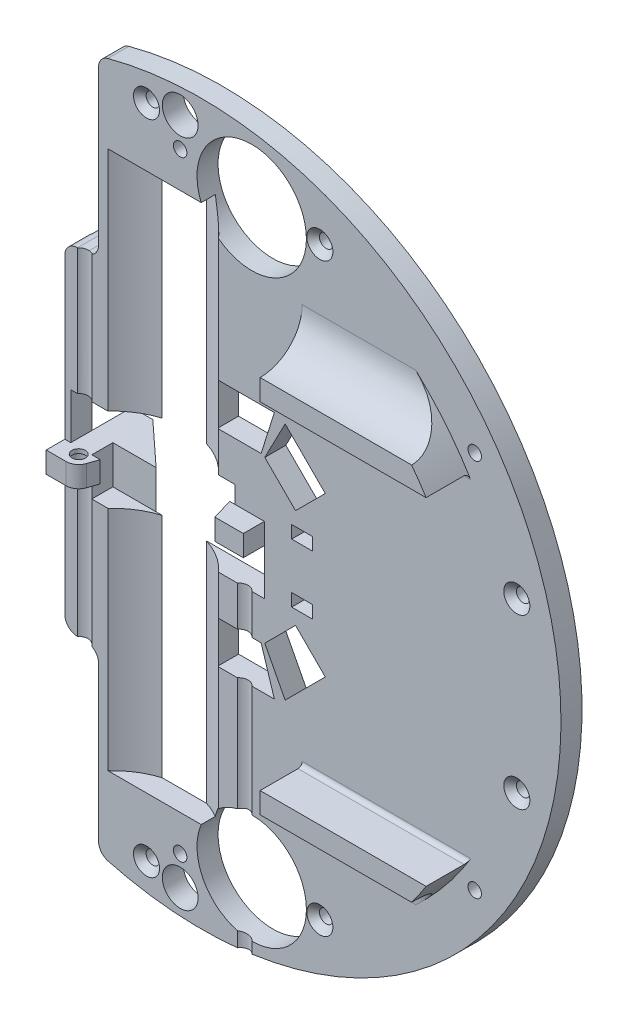
from build123d import *

# Parameters (mm, degrees)
SKETCH1_R               = 1.6
SKETCH1_R_2             = 4.25
SKETCH1_R_3             = 13
BOSS_EXTRUDE2_DEPTH     = 5
BOSS_EXTRUDE3_DEPTH     = 10
FILLET1_R               = 10
FILLET2_R               = 1
SKETCH5_R               = 1.6
CUT_EXTRUDE2_DEPTH      = 10
CHAMFER1_SIZE           = 1.5
CHAMFER2_SIZE           = 1.5
CUT_EXTRUDE3_DEPTH      = 10
CUT_EXTRUDE4_DEPTH      = 64
CUT_EXTRUDE4_DEPTH_BACK = 64
SKETCH10_R              = 17.8
CUT_EXTRUDE5_DEPTH      = 62.5
SKETCH13_W              = 8.207106088
SKETCH13_H              = 5
BOSS_EXTRUDE4_DEPTH     = 5
CUT_EXTRUDE6_DEPTH      = 110
CUT_EXTRUDE6_DEPTH_BACK = 4
SKETCH14_R              = 2.25
CUT_EXTRUDE7_DEPTH      = 15
SKETCH16_W              = 8.411411006
SKETCH16_H              = 5
BOSS_EXTRUDE5_DEPTH     = 5
CUT_EXTRUDE8_DEPTH      = 40
CUT_EXTRUDE8_DEPTH_BACK = 4
SKETCH17_R              = 2.25
CUT_EXTRUDE9_DEPTH      = 7
SKETCH19_R              = 1.6
CUT_EXTRUDE10_DEPTH     = 7
CUT_EXTRUDE11_START     = 45
SKETCH20_R              = 2.25
CUT_EXTRUDE11_DEPTH     = 45
SKETCH21_W              = 63.368942454
SKETCH21_H              = 8
CUT_EXTRUDE12_DEPTH     = 3
SKETCH22_W              = 5
SKETCH22_H              = 3
CUT_EXTRUDE13_DEPTH     = 5
FILLET3_R               = 3
BOSS_EXTRUDE6_DEPTH     = 9.5
SKETCH25_R              = 2.25
CUT_EXTRUDE14_DEPTH     = 9.5
BOSS_EXTRUDE7_DEPTH     = 30.35
BOSS_EXTRUDE8_DEPTH     = 39.45


# Some blends are built 0.0001 mm under size
with BuildPart() as part:
    # Sketch1 → Boss-Extrude2 (new body)
    with BuildSketch(Plane(origin=(0, 0, 0), x_dir=(0, 1, 0), z_dir=(0, 0, 1))):
        with BuildLine():
            Line((-40, 24.388755563), (-40, 32.411411006))
            Line((-40, 32.411411006), (40, 32.411411006))
            Line((40, 32.411411006), (40, 24.411411006))
            Line((40, 24.411411006), (81.941033754, 24.411411006))
            ThreePointArc((81.941033754, 24.411411006), (0.011819235, -85.499999183), (-81.947779727, 24.388755563))
            Line((-81.947779727, 24.388755563), (-40, 24.388755563))
        make_face()
        with Locations(Location((-20, -75, 0), (0, 0, 270))):
            Circle(SKETCH1_R, mode=Mode.SUBTRACT)
        with Locations(Location((20, -75, 0), (0, 0, 90))):
            Circle(SKETCH1_R, mode=Mode.SUBTRACT)
        with Locations(Location((-69.5, -28.2, 0), (0, 0, 270))):
            Circle(SKETCH1_R, mode=Mode.SUBTRACT)
        with Locations(Location((-78, 13, 0), (0, 0, 90))):
            Circle(SKETCH1_R, mode=Mode.SUBTRACT)
        with Locations(Location((-79.5, 5, 0), (0, 0, 90))):
            Circle(SKETCH1_R_2, mode=Mode.SUBTRACT)
        with Locations(Location((-69, -12, 0), (0, 0, 90))):
            Circle(SKETCH1_R_3, mode=Mode.SUBTRACT)
        with Locations(Location((69, -12, 0), (0, 0, 270))):
            Circle(SKETCH1_R_3, mode=Mode.SUBTRACT)
        with Locations(Location((79.5, 5, 0), (0, 0, 270))):
            Circle(SKETCH1_R_2, mode=Mode.SUBTRACT)
        with Locations(Location((78, 13, 0), (0, 0, 270))):
            Circle(SKETCH1_R, mode=Mode.SUBTRACT)
        with Locations(Location((69.5, -28.2, 0), (0, 0, 90))):
            Circle(SKETCH1_R, mode=Mode.SUBTRACT)
    extrude(amount=BOSS_EXTRUDE2_DEPTH)

    # Sketch2 → Boss-Extrude3 (add)
    with BuildSketch(Plane.XY.offset(5)):
        with BuildLine():
            Line((60, 45), (24, 45))
            Line((24, 45), (24, 40))
            Line((24, 40), (63.442887702, 40))
            ThreePointArc((63.442887702, 40), (61.772053803, 42.534848876), (60, 45))
        make_face()
        with BuildLine():
            Line((24, -45), (24, -40))
            Line((24, -40), (63.442887702, -40))
            ThreePointArc((63.442887702, -40), (61.772053803, -42.534848876), (60, -45))
            Line((60, -45), (24, -45))
        make_face()
    extrude(amount=BOSS_EXTRUDE3_DEPTH)

    # Fillet1
    fillet1_edges = [part.edges().sort_by_distance(p)[0] for p in [
        (42, -45, 5),
        (42, 45, 5),
    ]]
    fillet(fillet1_edges, radius=FILLET1_R - 0.0001)  # a hair under: the kernel refuses the full size

    # Fillet2
    fillet2_edges = [part.edges().sort_by_distance(p)[0] for p in [
        (43.721443851, 40, 5),
        (43.721443851, -40, 5),
    ]]
    fillet(fillet2_edges, radius=FILLET2_R)

    # Sketch5 → Cut-Extrude2 (cut)
    with BuildSketch(Plane.XY.offset(5)):
        with Locations((65, 45)):
            Circle(SKETCH5_R)
        with Locations((-5, 72.5)):
            Circle(SKETCH5_R)
        with Locations((65, -45)):
            Circle(SKETCH5_R)
        with Locations((-5, -72.5)):
            Circle(SKETCH5_R)
    extrude(amount=-CUT_EXTRUDE2_DEPTH, mode=Mode.SUBTRACT)

    # Chamfer1
    chamfer1_edges = [part.edges().sort_by_distance(p)[0] for p in [
        (73.4, -20, 5),
        (76.6, 20, 5),
        (26.6, -69.5, 5),
        (-11.4, -78, 5),
        (-14.6, 78, 5),
        (29.8, 69.5, 5),
    ]]
    chamfer(chamfer1_edges, length=CHAMFER1_SIZE)

    # Chamfer2
    # the kernel refuses this chamfer: 1.5 mm, written as the material it takes off along each edge
    with BuildSketch(Plane(origin=(-5, -72.5, 0), x_dir=(1, 0, 0), z_dir=(0, -1, 0))) as chamfer2_piece_1:
        Polygon((1.6, CHAMFER2_SIZE), (1.6 + CHAMFER2_SIZE, 0), (1.6, 0), align=None)
    revolve(axis=Axis((-5, -72.5, 0), (0, 0, 1)), mode=Mode.SUBTRACT)
    with BuildSketch(Plane(origin=(65, -45, 0), x_dir=(1, 0, 0), z_dir=(0, -1, 0))) as chamfer2_piece_2:
        Polygon((1.6, CHAMFER2_SIZE), (1.6 + CHAMFER2_SIZE, 0), (1.6, 0), align=None)
    revolve(axis=Axis((65, -45, 0), (0, 0, 1)), mode=Mode.SUBTRACT)
    with BuildSketch(Plane(origin=(-5, 72.5, 0), x_dir=(1, 0, 0), z_dir=(0, -1, 0))) as chamfer2_piece_3:
        Polygon((1.6, CHAMFER2_SIZE), (1.6 + CHAMFER2_SIZE, 0), (1.6, 0), align=None)
    revolve(axis=Axis((-5, 72.5, 0), (0, 0, 1)), mode=Mode.SUBTRACT)
    with BuildSketch(Plane(origin=(65, 45, 0), x_dir=(1, 0, 0), z_dir=(0, -1, 0))) as chamfer2_piece_4:
        Polygon((1.6, CHAMFER2_SIZE), (1.6 + CHAMFER2_SIZE, 0), (1.6, 0), align=None)
    revolve(axis=Axis((65, 45, 0), (0, 0, 1)), mode=Mode.SUBTRACT)

    # Sketch9 → Cut-Extrude3 (cut)
    with BuildSketch(Plane.XY.offset(5)):
        Polygon((14.237615434, -19.486352775), (3.879751058, -19.486352775), (3.879751058, -29.486352775), (17.379751058, -29.486352775), align=None)
        Polygon((15.10847152, -19.115496689), (22.415284964, -11.808683246), (29.486352775, -18.879751058), (19.940411229, -28.425692604), align=None)
        Polygon((17.379751058, 29.486352775), (14.237615434, 19.486352775), (3.879751058, 19.486352775), (3.879751058, 29.486352775), align=None)
        Polygon((15.10847152, 19.115496689), (19.940411229, 28.425692604), (29.486352775, 18.879751058), (22.415284964, 11.808683246), align=None)
    extrude(amount=-CUT_EXTRUDE3_DEPTH, mode=Mode.SUBTRACT)

    # Sketch10 → Cut-Extrude4 (cut, two sides: drawn at the far end of the back side and taken through both)
    with BuildSketch(Plane(origin=(0, 0, 0), x_dir=(-1, 0, 0), z_dir=(0, 1, 0)).offset(-CUT_EXTRUDE4_DEPTH_BACK)):
        with Locations((9, 17)):
            Circle(SKETCH10_R)
    extrude(amount=CUT_EXTRUDE4_DEPTH + CUT_EXTRUDE4_DEPTH_BACK, mode=Mode.SUBTRACT)

    # Sketch11 → Cut-Extrude5 (cut)
    with BuildSketch(Plane.XY.offset(5)):
        Polygon((-26, -0.9), (-31, -0.9), (-31, 10), (-25, 10), (8, 10), (8, 0.9), (15, 0.9), (15, -10), (-26, -10), align=None)
    extrude(amount=-CUT_EXTRUDE5_DEPTH, mode=Mode.SUBTRACT)

    # Sketch13 → Boss-Extrude4 (add)
    with BuildSketch(Plane.XY.offset(5)):
        with Locations((10.896446956, 3.4)):
            Rectangle(SKETCH13_W, SKETCH13_H)
    extrude(amount=BOSS_EXTRUDE4_DEPTH)

    # Sketch14 → Cut-Extrude6 (cut, two sides: drawn at the far end of the back side and taken through both)
    with BuildSketch(Plane.XZ.offset(-0.9).offset(-CUT_EXTRUDE6_DEPTH_BACK)):
        with Locations(Location((10.329881394, 6.439198103, 0), (0, 0, 90))):
            Circle(SKETCH14_R)
    extrude(amount=CUT_EXTRUDE6_DEPTH + CUT_EXTRUDE6_DEPTH_BACK, mode=Mode.SUBTRACT)

    # Sketch15 → Cut-Extrude7 (cut)
    with BuildSketch(Plane.XZ.offset(-0.9)):
        Polygon((6.792893912, 5), (6.792893912, 10), (8.234128763, 10), align=None)
    extrude(amount=-CUT_EXTRUDE7_DEPTH, mode=Mode.SUBTRACT)

    # Sketch16 → Boss-Extrude5 (add)
    with BuildSketch(Plane.XY.offset(5)):
        with Locations((-28.205705503, -3.4)):
            Rectangle(SKETCH16_W, SKETCH16_H)
    extrude(amount=BOSS_EXTRUDE5_DEPTH)

    # Sketch17 → Cut-Extrude8 (cut, two sides: drawn at the far end of the back side and taken through both)
    with BuildSketch(Plane.XZ.offset(5.9).offset(-CUT_EXTRUDE8_DEPTH_BACK)):
        with Locations((-27.66829088, 6.439198103)):
            Circle(SKETCH17_R)
    extrude(amount=CUT_EXTRUDE8_DEPTH + CUT_EXTRUDE8_DEPTH_BACK, mode=Mode.SUBTRACT)

    # Sketch18 → Cut-Extrude9 (cut)
    with BuildSketch(Plane.XZ.offset(5.9)):
        with BuildLine():
            Line((-24, 5), (-24.831401452, 7.415599283))
            ThreePointArc((-24.831401452, 7.415599283), (-25.925895164, 8.881606353), (-27.66829088, 9.43941491))
            Line((-27.66829088, 9.43941491), (-32.411411006, 9.43941491))
            Line((-32.411411006, 9.43941491), (-32.411411006, 10))
            Line((-32.411411006, 10), (-25.720901016, 10))
            Line((-25.720901016, 10), (-24, 10))
            Line((-24, 10), (-24, 5))
        make_face()
    extrude(amount=-CUT_EXTRUDE9_DEPTH, mode=Mode.SUBTRACT)

    # Sketch19 → Cut-Extrude10 (cut)
    with BuildSketch(Plane.XZ.offset(1.9)):
        with Locations(Location((-27.66829088, 6.439198103, 0), (0, 0, 270))):
            Circle(SKETCH19_R)
    extrude(amount=-CUT_EXTRUDE10_DEPTH, mode=Mode.SUBTRACT)

    # Sketch20 → Cut-Extrude11 (cut)
    with BuildSketch(Plane(origin=(0, -0.9, 0), x_dir=(-1, 0, 0), z_dir=(0, 1, 0)).offset(CUT_EXTRUDE11_START)):
        with Locations((27.66829088, 6.439198103)):
            Circle(SKETCH20_R)
    extrude(amount=-CUT_EXTRUDE11_DEPTH, mode=Mode.SUBTRACT)

    # Sketch21 → Cut-Extrude12 (cut)
    with BuildSketch(Plane(origin=(0, 0, 0), x_dir=(1, 0, 0), z_dir=(0, 0, -1))):
        with Locations((38.053519701, 0)):
            Rectangle(SKETCH21_W, SKETCH21_H)
    extrude(amount=-CUT_EXTRUDE12_DEPTH, mode=Mode.SUBTRACT)

    # Sketch22 → Cut-Extrude13 (cut)
    with BuildSketch(Plane(origin=(0, 0, 0), x_dir=(1, 0, 0), z_dir=(0, 0, -1))):
        with Locations((24, -7)):
            Rectangle(SKETCH22_W, SKETCH22_H)
        with Locations((24, 7)):
            Rectangle(SKETCH22_W, SKETCH22_H)
    extrude(amount=-CUT_EXTRUDE13_DEPTH, mode=Mode.SUBTRACT)

    # Fillet3
    fillet3_edges = [part.edges().sort_by_distance(p)[0] for p in [
        (-32.411411006, 40, 2.5),
        (-24.411411006, 40, 2.5),
        (-24.411411006, 81.941033754, 2.5),
        (-24.388755563, -81.947779727, 2.5),
        (-24.388755563, -40, 2.5),
        (-32.411411006, -40, 2.5),
    ]]
    fillet(fillet3_edges, radius=FILLET3_R)

    # Sketch24 → Boss-Extrude6 (add)
    with BuildSketch(Plane(origin=(0, 0, 0), x_dir=(1, 0, 0), z_dir=(0, 0, -1))):
        with BuildLine():
            Line((-31, 0.9), (-31, 39.544874262))
            ThreePointArc((-31, 39.544874262), (-30.237660731, 39.883974929), (-29.411411006, 40))
            Line((-29.411411006, 40), (-27.388755563, 40.00396519))
            ThreePointArc((-27.388755563, 40.00396519), (-26.673714984, 40.090542739), (-26, 40.345271657))
            Line((-26, 40.345271657), (-26, 0.9))
            Line((-26, 0.9), (-31, 0.9))
        make_face()
        with BuildLine():
            Line((-29.411411006, -40), (-27.388755563, -40.00396519))
            ThreePointArc((-27.388755563, -40.00396519), (-26.673714984, -40.090542739), (-26, -40.345271657))
            Line((-26, -40.345271657), (-26, -10))
            Line((-26, -10), (-31, -10))
            Line((-31, -10), (-31, -39.544874262))
            ThreePointArc((-31, -39.544874262), (-30.237660731, -39.883974929), (-29.411411006, -40))
        make_face()
    extrude(amount=BOSS_EXTRUDE6_DEPTH)

    # Sketch25 → Cut-Extrude14 (cut)
    with BuildSketch(Plane(origin=(-31, 0, 0), x_dir=(0, -1, 0), z_dir=(-1, 0, 0))):
        with Locations(Location((13, -5.25, 0), (0, 0, 90))):
            Circle(SKETCH25_R)
        with Locations(Location((-13, -5.25, 0), (0, 0, 90))):
            Circle(SKETCH25_R)
    extrude(amount=-CUT_EXTRUDE14_DEPTH, mode=Mode.SUBTRACT)

    # Sketch27 → Boss-Extrude7 (add)
    with BuildSketch(Plane.XZ.offset(-10)):
        Polygon((-26, -9.5), (-15.716518099, 0), (-26, 0), align=None)
    extrude(amount=-BOSS_EXTRUDE7_DEPTH)

    # Sketch28 → Boss-Extrude8 (add)
    with BuildSketch(Plane(origin=(0, -0.9, 0), x_dir=(-1, 0, 0), z_dir=(0, 1, 0))):
        Polygon((26, -9.5), (15.716518099, 0), (26, 0), align=None)
    extrude(amount=-BOSS_EXTRUDE8_DEPTH)


solid = part.part
